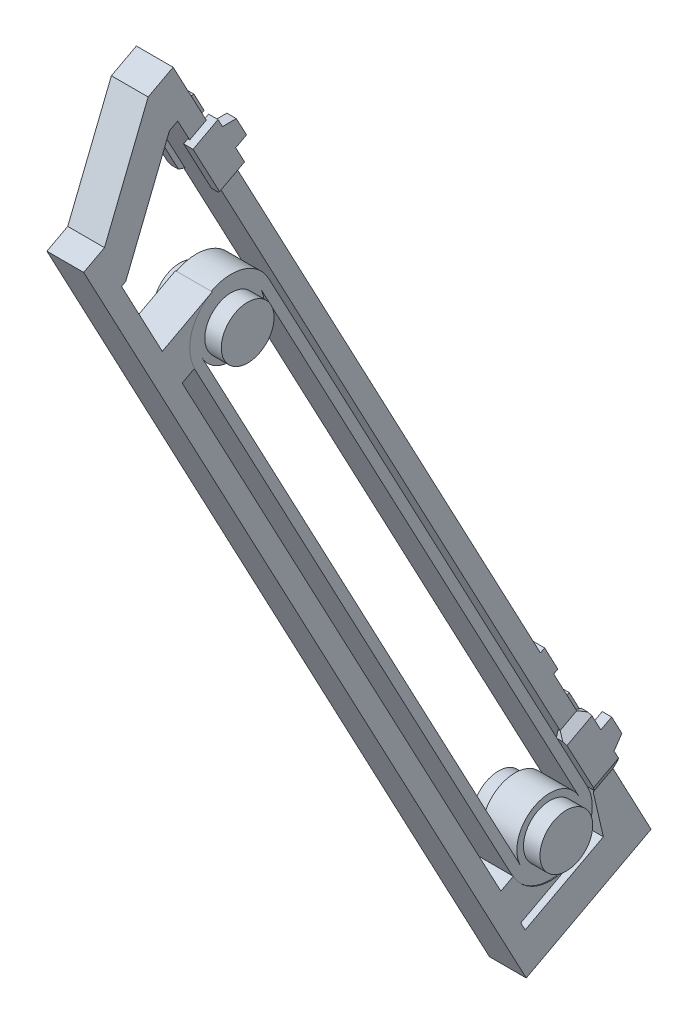
from build123d import *

# Parameters (mm, degrees)
BOSS_EXTRUDE1_DEPTH   = 19.5
SKETCH3_R             = 28
BOSS_EXTRUDE2_DEPTH   = 36
BOSS_EXTRUDE2_2_DEPTH = 36
SKETCH4_R             = 35
BOSS_EXTRUDE3_DEPTH   = 18.5
BOSS_EXTRUDE4_DEPTH   = 18.5
BOSS_EXTRUDE5_START   = -2
BOSS_EXTRUDE5_DEPTH   = 10
MIRROR2_START         = -2
MIRROR2_COPY_1_DEPTH  = 10
CHAMFER1_SIZE         = 8
CHAMFER2_SIZE         = 13.856406461
CHAMFER2_SIZE_2       = 8
CHAMFER2_SIZE_3       = 9.797958971
BOSS_EXTRUDE6_START   = -39
BOSS_EXTRUDE6_DEPTH   = 39
SKETCH8_W             = 39
SKETCH8_H             = 30
BOSS_EXTRUDE7_DEPTH   = 5


with BuildPart() as part:
    # Sketch2 → Boss-Extrude1 (new, symmetric)
    with BuildSketch(Plane(origin=(0, 0, 0), x_dir=(0, 0, -1), z_dir=(1, 0, 0))):
        Polygon((0, 0), (132.442138929, 70.420734418), (-374.58714888, 1024.004134706), (-401.075576666, 1009.919987822), (-447.397872964, 894.684381929), (-469.471562786, 882.947592859), align=None)
        Polygon((-369.711465723, 972.233218993), (-378.540941652, 967.538503365), (-424.863237951, 852.302897471), (-429.277975915, 849.955539657), (-1.119910654, 44.70733497), (81.809218892, 88.801535309), (67.836030793, 149.326062448), align=None, mode=Mode.SUBTRACT)
    extrude(amount=BOSS_EXTRUDE1_DEPTH, both=True)

    # Sketch6 → Boss-Extrude5 (add)
    with BuildSketch(Plane(origin=(19.5, 0, 0), x_dir=(0, 0, -1), z_dir=(1, 0, 0)).offset(BOSS_EXTRUDE5_START)):
        Polygon((-361.450471492, 946.046276171), (-334.962043707, 960.130423055), (-330.267328079, 951.300947126), (-315.54391742, 951.300947126), (-304.704862488, 930.915649657), (-316.183181195, 924.812519341), (-306.79374994, 907.153567483), (-333.282177725, 893.0694206), align=None)
    boss_extrude5 = extrude(amount=BOSS_EXTRUDE5_DEPTH)

    # Mirror1: Boss-Extrude5 across plane
    add(boss_extrude5.mirror(Plane(origin=(0, 0, 0), x_dir=(0, 0, 1), z_dir=(1, 0, 0))))

    # Mirror2: Boss-Extrude5 across plane
    add(boss_extrude5.mirror(Plane(origin=(0, 487.828545055, 259.383038439), x_dir=(0, -0.4694715627858889, 0.8829475928589279), z_dir=(0, -0.882947592858928, -0.4694715627858889))))

    # Mirror2 copy 1 sketch → Mirror2 copy 1 (add)
    with BuildSketch(Plane(origin=(-19.5, 975.657090109, 518.766076878), x_dir=(0, 0.8290375725550394, -0.5591929034707503), z_dir=(-1, 0, 0)).offset(MIRROR2_START)):
        Polygon((-361.450471492, 946.046276171), (-334.962043707, 960.130423055), (-330.267328079, 951.300947126), (-315.54391742, 951.300947126), (-304.704862488, 930.915649657), (-316.183181195, 924.812519341), (-306.79374994, 907.153567483), (-333.282177725, 893.0694206), align=None)
    extrude(amount=MIRROR2_COPY_1_DEPTH)

    # Chamfer1
    # the kernel refuses this chamfer: 8 mm, written as the material it adds along each edge
    with BuildSketch(Plane(origin=(19.5, 895.416778414, 328.867439761), x_dir=(0, -0.8697052331433146, -0.49357148159423986), z_dir=(-1, 0, 0))) as chamfer1_piece_1_section:
        Polygon((CHAMFER1_SIZE * 0.999621916911, CHAMFER1_SIZE * 0.0274958766106), (-CHAMFER1_SIZE * 0.0274958766106, CHAMFER1_SIZE * 0.999621916911), (0, 0), align=None)
    chamfer1_piece_1 = extrude(amount=2, mode=Mode.PRIVATE)
    chamfer1_piece_1 = split(chamfer1_piece_1, bisect_by=Plane(origin=(18.5, 890.45049523, 331.889670405), z_dir=(0, 0.46947156278588875, -0.8829475928589281)), keep=Keep.TOP, mode=Mode.PRIVATE)
    add(chamfer1_piece_1)
    with BuildSketch(Plane(origin=(19.5, 895.416778414, 328.867439761), x_dir=(-0.027495876610586622, -0.8826137653058558, -0.4692940635273741), z_dir=(0, 0.46947156278589053, -0.8829475928589271))) as chamfer1_piece_2_section:
        Polygon((CHAMFER1_SIZE * 0.999621916911, -CHAMFER1_SIZE * 0.0274958766106), (-CHAMFER1_SIZE * 0.0274958766106, -CHAMFER1_SIZE * 0.999621916911), (0, 0), align=None)
    chamfer1_piece_2 = extrude(amount=20, mode=Mode.PRIVATE)
    chamfer1_piece_2 = split(chamfer1_piece_2, bisect_by=Plane(origin=(27.5, 897.77765762, 318.797040995), z_dir=(-1, 0, 0)), keep=Keep.TOP, mode=Mode.PRIVATE)
    add(chamfer1_piece_2)
    with BuildSketch(Plane(origin=(19.5, 904.80620967, 311.208487904), x_dir=(0, -0.8955222974683966, -0.4450166454605094), z_dir=(-1, 0, 0))) as chamfer1_piece_3_section:
        Polygon((CHAMFER1_SIZE * 0.999621916911, -CHAMFER1_SIZE * 0.0274958766106), (-CHAMFER1_SIZE * 0.0274958766106, -CHAMFER1_SIZE * 0.999621916911), (0, 0), align=None)
    chamfer1_piece_3 = extrude(amount=2, mode=Mode.PRIVATE)
    chamfer1_piece_3 = split(chamfer1_piece_3, bisect_by=Plane(origin=(18.5, 904.534642113, 305.401242619), z_dir=(0, -0.46947156278588786, 0.8829475928589285)), keep=Keep.TOP, mode=Mode.PRIVATE)
    add(chamfer1_piece_3)
    with BuildSketch(Plane(origin=(-19.5, 202.30291802, -39.667737026), x_dir=(0, 0.8955222974683965, 0.4450166454605094), z_dir=(1, 0, 0))) as chamfer1_piece_4_section:
        Polygon((CHAMFER1_SIZE * 0.999621916911, CHAMFER1_SIZE * 0.0274958766106), (-CHAMFER1_SIZE * 0.0274958766106, CHAMFER1_SIZE * 0.999621916911), (0, 0), align=None)
    chamfer1_piece_4 = extrude(amount=2, mode=Mode.PRIVATE)
    chamfer1_piece_4 = split(chamfer1_piece_4, bisect_by=Plane(origin=(-18.5, 202.574485576, -33.860491741), z_dir=(0, 0.46947156278588914, -0.8829475928589279)), keep=Keep.TOP, mode=Mode.PRIVATE)
    add(chamfer1_piece_4)
    with BuildSketch(Plane(origin=(-19.5, 211.692349275, -57.326688883), x_dir=(0.027495876610586403, 0.8826137653058576, 0.4692940635273708), z_dir=(0, -0.46947156278588736, 0.8829475928589289))) as chamfer1_piece_5_section:
        Polygon((CHAMFER1_SIZE * 0.999621916911, CHAMFER1_SIZE * 0.0274958766106), (-CHAMFER1_SIZE * 0.0274958766106, CHAMFER1_SIZE * 0.999621916911), (0, 0), align=None)
    chamfer1_piece_5 = extrude(amount=20, mode=Mode.PRIVATE)
    chamfer1_piece_5 = split(chamfer1_piece_5, bisect_by=Plane(origin=(-27.5, 209.331470069, -47.256290117), z_dir=(1, 0, 0)), keep=Keep.TOP, mode=Mode.PRIVATE)
    add(chamfer1_piece_5)
    with BuildSketch(Plane(origin=(-19.5, 211.692349275, -57.326688883), x_dir=(0, 0.8697052331433184, 0.49357148159423286), z_dir=(1, 0, 0))) as chamfer1_piece_6_section:
        Polygon((CHAMFER1_SIZE * 0.999621916911, -CHAMFER1_SIZE * 0.0274958766106), (-CHAMFER1_SIZE * 0.0274958766106, -CHAMFER1_SIZE * 0.999621916911), (0, 0), align=None)
    chamfer1_piece_6 = extrude(amount=2, mode=Mode.PRIVATE)
    chamfer1_piece_6 = split(chamfer1_piece_6, bisect_by=Plane(origin=(-18.5, 216.658632459, -60.348919527), z_dir=(0, -0.46947156278589003, 0.8829475928589274)), keep=Keep.TOP, mode=Mode.PRIVATE)
    add(chamfer1_piece_6)
    with BuildSketch(Plane(origin=(19.5, 202.30291802, -39.667737026), x_dir=(0, 0.8955222974683955, 0.4450166454605115), z_dir=(-1, 0, 0))) as chamfer1_piece_7_section:
        Polygon((CHAMFER1_SIZE * 0.999621916911, -CHAMFER1_SIZE * 0.0274958766106), (-CHAMFER1_SIZE * 0.0274958766106, -CHAMFER1_SIZE * 0.999621916911), (0, 0), align=None)
    chamfer1_piece_7 = extrude(amount=2, mode=Mode.PRIVATE)
    chamfer1_piece_7 = split(chamfer1_piece_7, bisect_by=Plane(origin=(18.5, 202.574485576, -33.860491741), z_dir=(0, 0.4694715627858891, -0.8829475928589279)), keep=Keep.TOP, mode=Mode.PRIVATE)
    add(chamfer1_piece_7)
    with BuildSketch(Plane(origin=(19.5, 202.30291802, -39.667737026), x_dir=(0.9996219169112968, -0.024277418066865994, -0.012908532162541309), z_dir=(0, 0.4694715627858873, -0.8829475928589289))) as chamfer1_piece_8_section:
        Polygon((CHAMFER1_SIZE * 0.999621916911, -CHAMFER1_SIZE * 0.0274958766106), (-CHAMFER1_SIZE * 0.0274958766106, -CHAMFER1_SIZE * 0.999621916911), (0, 0), align=None)
    chamfer1_piece_8 = extrude(amount=20, mode=Mode.PRIVATE)
    chamfer1_piece_8 = split(chamfer1_piece_8, bisect_by=Plane(origin=(27.5, 209.331470069, -47.256290117), z_dir=(-1, 0, 0)), keep=Keep.TOP, mode=Mode.PRIVATE)
    add(chamfer1_piece_8)
    with BuildSketch(Plane(origin=(19.5, 211.692349275, -57.326688883), x_dir=(0, 0.8697052331433177, 0.493571481594234), z_dir=(-1, 0, 0))) as chamfer1_piece_9_section:
        Polygon((CHAMFER1_SIZE * 0.999621916911, CHAMFER1_SIZE * 0.0274958766106), (-CHAMFER1_SIZE * 0.0274958766106, CHAMFER1_SIZE * 0.999621916911), (0, 0), align=None)
    chamfer1_piece_9 = extrude(amount=2, mode=Mode.PRIVATE)
    chamfer1_piece_9 = split(chamfer1_piece_9, bisect_by=Plane(origin=(18.5, 216.658632459, -60.348919527), z_dir=(0, -0.4694715627858899, 0.8829475928589274)), keep=Keep.TOP, mode=Mode.PRIVATE)
    add(chamfer1_piece_9)
    with BuildSketch(Plane(origin=(-19.5, 895.416778414, 328.867439761), x_dir=(0, -0.8697052331433146, -0.49357148159423986), z_dir=(1, 0, 0))) as chamfer1_piece_10_section:
        Polygon((CHAMFER1_SIZE * 0.999621916911, -CHAMFER1_SIZE * 0.0274958766106), (-CHAMFER1_SIZE * 0.0274958766106, -CHAMFER1_SIZE * 0.999621916911), (0, 0), align=None)
    chamfer1_piece_10 = extrude(amount=2, mode=Mode.PRIVATE)
    chamfer1_piece_10 = split(chamfer1_piece_10, bisect_by=Plane(origin=(-18.5, 890.45049523, 331.889670405), z_dir=(0, 0.46947156278588875, -0.8829475928589281)), keep=Keep.TOP, mode=Mode.PRIVATE)
    add(chamfer1_piece_10)
    with BuildSketch(Plane(origin=(-19.5, 904.80620967, 311.208487904), x_dir=(-0.9996219169112972, 0.024277418066848726, 0.012908532162532243), z_dir=(0, -0.46947156278589053, 0.8829475928589271))) as chamfer1_piece_11_section:
        Polygon((CHAMFER1_SIZE * 0.999621916911, CHAMFER1_SIZE * 0.0274958766106), (-CHAMFER1_SIZE * 0.0274958766106, CHAMFER1_SIZE * 0.999621916911), (0, 0), align=None)
    chamfer1_piece_11 = extrude(amount=20, mode=Mode.PRIVATE)
    chamfer1_piece_11 = split(chamfer1_piece_11, bisect_by=Plane(origin=(-27.5, 897.77765762, 318.797040995), z_dir=(1, 0, 0)), keep=Keep.TOP, mode=Mode.PRIVATE)
    add(chamfer1_piece_11)
    with BuildSketch(Plane(origin=(-19.5, 904.80620967, 311.208487904), x_dir=(0, -0.8955222974683966, -0.4450166454605094), z_dir=(1, 0, 0))) as chamfer1_piece_12_section:
        Polygon((CHAMFER1_SIZE * 0.999621916911, CHAMFER1_SIZE * 0.0274958766106), (-CHAMFER1_SIZE * 0.0274958766106, CHAMFER1_SIZE * 0.999621916911), (0, 0), align=None)
    chamfer1_piece_12 = extrude(amount=2, mode=Mode.PRIVATE)
    chamfer1_piece_12 = split(chamfer1_piece_12, bisect_by=Plane(origin=(-18.5, 904.534642113, 305.401242619), z_dir=(0, -0.46947156278588786, 0.8829475928589285)), keep=Keep.TOP, mode=Mode.PRIVATE)
    add(chamfer1_piece_12)
    with BuildSketch(Plane(origin=(40.073463904, 895.416778414, 328.867439761), x_dir=(0, -0.8697052331433148, -0.4935714815942391), z_dir=(-1, 0, 0))) as chamfer1_piece_13a_section:
        Polygon((CHAMFER1_SIZE * 0.999621916911, CHAMFER1_SIZE * 0.0274958766106), (-CHAMFER1_SIZE * 0.0274958766106, CHAMFER1_SIZE * 0.999621916911), (0, 0), align=None)
    chamfer1_piece_13a = extrude(amount=22.573463904, mode=Mode.PRIVATE)
    chamfer1_piece_13a = split(chamfer1_piece_13a, bisect_by=Plane(origin=(19.5, 891.853347168, 329.251289638), z_dir=(1, 0, 0)), keep=Keep.TOP, mode=Mode.PRIVATE)
    chamfer1_piece_13a = split(chamfer1_piece_13a, bisect_by=Plane(origin=(23.5, 890.45049523, 331.889670405), z_dir=(0, 0.46947156278588875, -0.8829475928589281)), keep=Keep.TOP, mode=Mode.PRIVATE)
    chamfer1_piece_13a = split(chamfer1_piece_13a, bisect_by=Plane(origin=(27.5, 891.853347168, 329.251289638), z_dir=(-1, 0, 0)), keep=Keep.TOP, mode=Mode.PRIVATE)
    with BuildSketch(Plane(origin=(19.5, 885.758122163, 347.032730192), x_dir=(-0.027495876610586622, -0.8826137653058558, -0.4692940635273741), z_dir=(0, 0.46947156278589053, -0.8829475928589271))) as chamfer1_piece_13b_section:
        Polygon((CHAMFER1_SIZE * 0.999621916911, -CHAMFER1_SIZE * 0.0274958766106), (-CHAMFER1_SIZE * 0.0274958766106, -CHAMFER1_SIZE * 0.999621916911), (0, 0), align=None)
    chamfer1_piece_13b = extrude(amount=40.573463904, mode=Mode.PRIVATE)
    chamfer1_piece_13b = split(chamfer1_piece_13b, bisect_by=Plane(origin=(22.12907467, 893.082941992, 327.626516924), z_dir=(0, -0.46947156278588986, 0.8829475928589274)), keep=Keep.TOP, mode=Mode.PRIVATE)
    chamfer1_piece_13b = split(chamfer1_piece_13b, bisect_by=Plane(origin=(22.12907467, 890.735584178, 332.041254888), z_dir=(0, 0.46947156278588875, -0.8829475928589281)), keep=Keep.TOP, mode=Mode.PRIVATE)
    chamfer1_piece_13b = split(chamfer1_piece_13b, bisect_by=Plane(origin=(27.5, 891.909263085, 329.833885906), z_dir=(-1, 0, 0)), keep=Keep.TOP, mode=Mode.PRIVATE)
    chamfer1_piece_13 = chamfer1_piece_13a & chamfer1_piece_13b
    add(chamfer1_piece_13)
    with BuildSketch(Plane(origin=(40.073463904, 904.80620967, 311.208487904), x_dir=(0, -0.8955222974684021, -0.44501664546049835), z_dir=(-1, 0, 0))) as chamfer1_piece_14a_section:
        Polygon((CHAMFER1_SIZE * 0.999621916911, -CHAMFER1_SIZE * 0.0274958766106), (-CHAMFER1_SIZE * 0.0274958766106, -CHAMFER1_SIZE * 0.999621916911), (0, 0), align=None)
    chamfer1_piece_14a = extrude(amount=22.573463904, mode=Mode.PRIVATE)
    chamfer1_piece_14a = split(chamfer1_piece_14a, bisect_by=Plane(origin=(19.5, 903.131790175, 308.039623386), z_dir=(1, 0, 0)), keep=Keep.TOP, mode=Mode.PRIVATE)
    chamfer1_piece_14a = split(chamfer1_piece_14a, bisect_by=Plane(origin=(27.5, 903.131790175, 308.039623386), z_dir=(-1, 0, 0)), keep=Keep.TOP, mode=Mode.PRIVATE)
    chamfer1_piece_14a = split(chamfer1_piece_14a, bisect_by=Plane(origin=(23.5, 904.534642113, 305.401242619), z_dir=(0, -0.46947156278588786, 0.8829475928589285)), keep=Keep.TOP, mode=Mode.PRIVATE)
    with BuildSketch(Plane(origin=(19.5, 895.416778414, 328.867439761), x_dir=(-0.027495876610586622, -0.8826137653058558, -0.4692940635273741), z_dir=(0, 0.46947156278589053, -0.8829475928589271))) as chamfer1_piece_14b_section:
        Polygon((CHAMFER1_SIZE * 0.999621916911, -CHAMFER1_SIZE * 0.0274958766106), (-CHAMFER1_SIZE * 0.0274958766106, -CHAMFER1_SIZE * 0.999621916911), (0, 0), align=None)
    chamfer1_piece_14b = extrude(amount=40.573463904, mode=Mode.PRIVATE)
    chamfer1_piece_14b = split(chamfer1_piece_14b, bisect_by=Plane(origin=(22.12907467, 902.472373248, 309.967565066), z_dir=(0, 0.469471562785889, -0.882947592858928)), keep=Keep.TOP, mode=Mode.PRIVATE)
    chamfer1_piece_14b = split(chamfer1_piece_14b, bisect_by=Plane(origin=(27.5, 903.646052155, 307.760196084), z_dir=(-1, 0, 0)), keep=Keep.TOP, mode=Mode.PRIVATE)
    chamfer1_piece_14b = split(chamfer1_piece_14b, bisect_by=Plane(origin=(22.12907467, 904.819731062, 305.552827102), z_dir=(0, -0.46947156278588786, 0.8829475928589285)), keep=Keep.TOP, mode=Mode.PRIVATE)
    chamfer1_piece_14 = chamfer1_piece_14a & chamfer1_piece_14b
    add(chamfer1_piece_14)
    with BuildSketch(Plane(origin=(-40.073463904, 202.30291802, -39.667737026), x_dir=(0, 0.8955222974683965, 0.4450166454605094), z_dir=(1, 0, 0))) as chamfer1_piece_15a_section:
        Polygon((CHAMFER1_SIZE * 0.999621916911, CHAMFER1_SIZE * 0.0274958766106), (-CHAMFER1_SIZE * 0.0274958766106, CHAMFER1_SIZE * 0.999621916911), (0, 0), align=None)
    chamfer1_piece_15a = extrude(amount=22.573463904, mode=Mode.PRIVATE)
    chamfer1_piece_15a = split(chamfer1_piece_15a, bisect_by=Plane(origin=(-19.5, 203.977337514, -36.498872509), z_dir=(-1, 0, 0)), keep=Keep.TOP, mode=Mode.PRIVATE)
    chamfer1_piece_15a = split(chamfer1_piece_15a, bisect_by=Plane(origin=(-23.5, 202.574485576, -33.860491741), z_dir=(0, 0.46947156278588914, -0.8829475928589279)), keep=Keep.TOP, mode=Mode.PRIVATE)
    chamfer1_piece_15a = split(chamfer1_piece_15a, bisect_by=Plane(origin=(-27.5, 203.977337514, -36.498872509), z_dir=(1, 0, 0)), keep=Keep.TOP, mode=Mode.PRIVATE)
    with BuildSketch(Plane(origin=(-19.5, 211.692349275, -57.326688883), x_dir=(0.027495876610586403, 0.8826137653058576, 0.4692940635273708), z_dir=(0, -0.46947156278588736, 0.8829475928589289))) as chamfer1_piece_15b_section:
        Polygon((CHAMFER1_SIZE * 0.999621916911, CHAMFER1_SIZE * 0.0274958766106), (-CHAMFER1_SIZE * 0.0274958766106, CHAMFER1_SIZE * 0.999621916911), (0, 0), align=None)
    chamfer1_piece_15b = extrude(amount=40.573463904, mode=Mode.PRIVATE)
    chamfer1_piece_15b = split(chamfer1_piece_15b, bisect_by=Plane(origin=(-22.12907467, 204.636754441, -38.426814188), z_dir=(0, -0.46947156278588986, 0.8829475928589274)), keep=Keep.TOP, mode=Mode.PRIVATE)
    chamfer1_piece_15b = split(chamfer1_piece_15b, bisect_by=Plane(origin=(-22.12907467, 202.289396627, -34.012076224), z_dir=(0, 0.46947156278588914, -0.8829475928589279)), keep=Keep.TOP, mode=Mode.PRIVATE)
    chamfer1_piece_15b = split(chamfer1_piece_15b, bisect_by=Plane(origin=(-27.5, 203.463075534, -36.219445206), z_dir=(1, 0, 0)), keep=Keep.TOP, mode=Mode.PRIVATE)
    chamfer1_piece_15 = chamfer1_piece_15a & chamfer1_piece_15b
    add(chamfer1_piece_15)
    with BuildSketch(Plane(origin=(-40.073463904, 211.692349275, -57.326688883), x_dir=(0, 0.869705233143318, 0.49357148159423353), z_dir=(1, 0, 0))) as chamfer1_piece_16a_section:
        Polygon((CHAMFER1_SIZE * 0.999621916911, -CHAMFER1_SIZE * 0.0274958766106), (-CHAMFER1_SIZE * 0.0274958766106, -CHAMFER1_SIZE * 0.999621916911), (0, 0), align=None)
    chamfer1_piece_16a = extrude(amount=22.573463904, mode=Mode.PRIVATE)
    chamfer1_piece_16a = split(chamfer1_piece_16a, bisect_by=Plane(origin=(-19.5, 215.255780521, -57.71053876), z_dir=(-1, 0, 0)), keep=Keep.TOP, mode=Mode.PRIVATE)
    chamfer1_piece_16a = split(chamfer1_piece_16a, bisect_by=Plane(origin=(-27.5, 215.255780521, -57.71053876), z_dir=(1, 0, 0)), keep=Keep.TOP, mode=Mode.PRIVATE)
    chamfer1_piece_16a = split(chamfer1_piece_16a, bisect_by=Plane(origin=(-23.5, 216.658632459, -60.348919527), z_dir=(0, -0.46947156278589003, 0.8829475928589274)), keep=Keep.TOP, mode=Mode.PRIVATE)
    with BuildSketch(Plane(origin=(-19.5, 221.351005526, -75.491979314), x_dir=(0.02749587661058658, 0.8826137653058576, 0.46929406352737085), z_dir=(0, -0.46947156278588736, 0.8829475928589289))) as chamfer1_piece_16b_section:
        Polygon((CHAMFER1_SIZE * 0.999621916911, CHAMFER1_SIZE * 0.0274958766106), (-CHAMFER1_SIZE * 0.0274958766106, CHAMFER1_SIZE * 0.999621916911), (0, 0), align=None)
    chamfer1_piece_16b = extrude(amount=40.573463904, mode=Mode.PRIVATE)
    chamfer1_piece_16b = split(chamfer1_piece_16b, bisect_by=Plane(origin=(-22.12907467, 214.026185697, -56.085766046), z_dir=(0, 0.469471562785889, -0.882947592858928)), keep=Keep.TOP, mode=Mode.PRIVATE)
    chamfer1_piece_16b = split(chamfer1_piece_16b, bisect_by=Plane(origin=(-27.5, 215.199864604, -58.293135028), z_dir=(1, 0, 0)), keep=Keep.TOP, mode=Mode.PRIVATE)
    chamfer1_piece_16b = split(chamfer1_piece_16b, bisect_by=Plane(origin=(-22.12907467, 216.373543511, -60.50050401), z_dir=(0, -0.46947156278589003, 0.8829475928589274)), keep=Keep.TOP, mode=Mode.PRIVATE)
    chamfer1_piece_16 = chamfer1_piece_16a & chamfer1_piece_16b
    add(chamfer1_piece_16)
    with BuildSketch(Plane(origin=(40.073463904, 202.30291802, -39.667737026), x_dir=(0, 0.8955222974683955, 0.4450166454605115), z_dir=(-1, 0, 0))) as chamfer1_piece_17a_section:
        Polygon((CHAMFER1_SIZE * 0.999621916911, -CHAMFER1_SIZE * 0.0274958766106), (-CHAMFER1_SIZE * 0.0274958766106, -CHAMFER1_SIZE * 0.999621916911), (0, 0), align=None)
    chamfer1_piece_17a = extrude(amount=22.573463904, mode=Mode.PRIVATE)
    chamfer1_piece_17a = split(chamfer1_piece_17a, bisect_by=Plane(origin=(19.5, 203.977337514, -36.498872509), z_dir=(1, 0, 0)), keep=Keep.TOP, mode=Mode.PRIVATE)
    chamfer1_piece_17a = split(chamfer1_piece_17a, bisect_by=Plane(origin=(23.5, 202.574485576, -33.860491741), z_dir=(0, 0.4694715627858891, -0.8829475928589279)), keep=Keep.TOP, mode=Mode.PRIVATE)
    chamfer1_piece_17a = split(chamfer1_piece_17a, bisect_by=Plane(origin=(27.5, 203.977337514, -36.498872509), z_dir=(-1, 0, 0)), keep=Keep.TOP, mode=Mode.PRIVATE)
    with BuildSketch(Plane(origin=(19.5, 192.644261769, -21.502446595), x_dir=(0.999621916911297, -0.024277418066861695, -0.012908532162539026), z_dir=(0, 0.4694715627858873, -0.8829475928589289))) as chamfer1_piece_17b_section:
        Polygon((CHAMFER1_SIZE * 0.999621916911, -CHAMFER1_SIZE * 0.0274958766106), (-CHAMFER1_SIZE * 0.0274958766106, -CHAMFER1_SIZE * 0.999621916911), (0, 0), align=None)
    chamfer1_piece_17b = extrude(amount=40.573463904, mode=Mode.PRIVATE)
    chamfer1_piece_17b = split(chamfer1_piece_17b, bisect_by=Plane(origin=(22.12907467, 204.636754441, -38.426814188), z_dir=(0, -0.46947156278588986, 0.8829475928589274)), keep=Keep.TOP, mode=Mode.PRIVATE)
    chamfer1_piece_17b = split(chamfer1_piece_17b, bisect_by=Plane(origin=(22.12907467, 202.289396627, -34.012076224), z_dir=(0, 0.4694715627858891, -0.8829475928589279)), keep=Keep.TOP, mode=Mode.PRIVATE)
    chamfer1_piece_17b = split(chamfer1_piece_17b, bisect_by=Plane(origin=(27.5, 203.463075534, -36.219445206), z_dir=(-1, 0, 0)), keep=Keep.TOP, mode=Mode.PRIVATE)
    chamfer1_piece_17 = chamfer1_piece_17a & chamfer1_piece_17b
    add(chamfer1_piece_17)
    with BuildSketch(Plane(origin=(40.073463904, 211.692349275, -57.326688883), x_dir=(0, 0.8697052331433165, 0.49357148159423614), z_dir=(-1, 0, 0))) as chamfer1_piece_18a_section:
        Polygon((CHAMFER1_SIZE * 0.999621916911, CHAMFER1_SIZE * 0.0274958766106), (-CHAMFER1_SIZE * 0.0274958766106, CHAMFER1_SIZE * 0.999621916911), (0, 0), align=None)
    chamfer1_piece_18a = extrude(amount=22.573463904, mode=Mode.PRIVATE)
    chamfer1_piece_18a = split(chamfer1_piece_18a, bisect_by=Plane(origin=(19.5, 215.255780521, -57.71053876), z_dir=(1, 0, 0)), keep=Keep.TOP, mode=Mode.PRIVATE)
    chamfer1_piece_18a = split(chamfer1_piece_18a, bisect_by=Plane(origin=(27.5, 215.255780521, -57.71053876), z_dir=(-1, 0, 0)), keep=Keep.TOP, mode=Mode.PRIVATE)
    chamfer1_piece_18a = split(chamfer1_piece_18a, bisect_by=Plane(origin=(23.5, 216.658632459, -60.348919527), z_dir=(0, -0.4694715627858899, 0.8829475928589274)), keep=Keep.TOP, mode=Mode.PRIVATE)
    with BuildSketch(Plane(origin=(19.5, 202.30291802, -39.667737026), x_dir=(0.9996219169112968, -0.024277418066865994, -0.012908532162541309), z_dir=(0, 0.4694715627858873, -0.8829475928589289))) as chamfer1_piece_18b_section:
        Polygon((CHAMFER1_SIZE * 0.999621916911, -CHAMFER1_SIZE * 0.0274958766106), (-CHAMFER1_SIZE * 0.0274958766106, -CHAMFER1_SIZE * 0.999621916911), (0, 0), align=None)
    chamfer1_piece_18b = extrude(amount=40.573463904, mode=Mode.PRIVATE)
    chamfer1_piece_18b = split(chamfer1_piece_18b, bisect_by=Plane(origin=(22.12907467, 214.026185697, -56.085766046), z_dir=(0, 0.469471562785889, -0.882947592858928)), keep=Keep.TOP, mode=Mode.PRIVATE)
    chamfer1_piece_18b = split(chamfer1_piece_18b, bisect_by=Plane(origin=(27.5, 215.199864604, -58.293135028), z_dir=(-1, 0, 0)), keep=Keep.TOP, mode=Mode.PRIVATE)
    chamfer1_piece_18b = split(chamfer1_piece_18b, bisect_by=Plane(origin=(22.12907467, 216.373543511, -60.50050401), z_dir=(0, -0.4694715627858899, 0.8829475928589274)), keep=Keep.TOP, mode=Mode.PRIVATE)
    chamfer1_piece_18 = chamfer1_piece_18a & chamfer1_piece_18b
    add(chamfer1_piece_18)
    with BuildSketch(Plane(origin=(-40.073463904, 895.416778414, 328.867439761), x_dir=(0, -0.8697052331433148, -0.4935714815942391), z_dir=(1, 0, 0))) as chamfer1_piece_19a_section:
        Polygon((CHAMFER1_SIZE * 0.999621916911, -CHAMFER1_SIZE * 0.0274958766106), (-CHAMFER1_SIZE * 0.0274958766106, -CHAMFER1_SIZE * 0.999621916911), (0, 0), align=None)
    chamfer1_piece_19a = extrude(amount=22.573463904, mode=Mode.PRIVATE)
    chamfer1_piece_19a = split(chamfer1_piece_19a, bisect_by=Plane(origin=(-19.5, 891.853347168, 329.251289638), z_dir=(-1, 0, 0)), keep=Keep.TOP, mode=Mode.PRIVATE)
    chamfer1_piece_19a = split(chamfer1_piece_19a, bisect_by=Plane(origin=(-23.5, 890.45049523, 331.889670405), z_dir=(0, 0.46947156278588875, -0.8829475928589281)), keep=Keep.TOP, mode=Mode.PRIVATE)
    chamfer1_piece_19a = split(chamfer1_piece_19a, bisect_by=Plane(origin=(-27.5, 891.853347168, 329.251289638), z_dir=(1, 0, 0)), keep=Keep.TOP, mode=Mode.PRIVATE)
    with BuildSketch(Plane(origin=(-19.5, 904.80620967, 311.208487904), x_dir=(-0.9996219169112972, 0.024277418066848726, 0.012908532162532243), z_dir=(0, -0.46947156278589053, 0.8829475928589271))) as chamfer1_piece_19b_section:
        Polygon((CHAMFER1_SIZE * 0.999621916911, CHAMFER1_SIZE * 0.0274958766106), (-CHAMFER1_SIZE * 0.0274958766106, CHAMFER1_SIZE * 0.999621916911), (0, 0), align=None)
    chamfer1_piece_19b = extrude(amount=40.573463904, mode=Mode.PRIVATE)
    chamfer1_piece_19b = split(chamfer1_piece_19b, bisect_by=Plane(origin=(-22.12907467, 893.082941992, 327.626516924), z_dir=(0, -0.46947156278588986, 0.8829475928589274)), keep=Keep.TOP, mode=Mode.PRIVATE)
    chamfer1_piece_19b = split(chamfer1_piece_19b, bisect_by=Plane(origin=(-22.12907467, 890.735584178, 332.041254888), z_dir=(0, 0.46947156278588875, -0.8829475928589281)), keep=Keep.TOP, mode=Mode.PRIVATE)
    chamfer1_piece_19b = split(chamfer1_piece_19b, bisect_by=Plane(origin=(-27.5, 891.909263085, 329.833885906), z_dir=(1, 0, 0)), keep=Keep.TOP, mode=Mode.PRIVATE)
    chamfer1_piece_19 = chamfer1_piece_19a & chamfer1_piece_19b
    add(chamfer1_piece_19)
    with BuildSketch(Plane(origin=(-40.073463904, 904.80620967, 311.208487904), x_dir=(0, -0.8955222974684021, -0.44501664546049835), z_dir=(1, 0, 0))) as chamfer1_piece_20a_section:
        Polygon((CHAMFER1_SIZE * 0.999621916911, CHAMFER1_SIZE * 0.0274958766106), (-CHAMFER1_SIZE * 0.0274958766106, CHAMFER1_SIZE * 0.999621916911), (0, 0), align=None)
    chamfer1_piece_20a = extrude(amount=22.573463904, mode=Mode.PRIVATE)
    chamfer1_piece_20a = split(chamfer1_piece_20a, bisect_by=Plane(origin=(-19.5, 903.131790175, 308.039623386), z_dir=(-1, 0, 0)), keep=Keep.TOP, mode=Mode.PRIVATE)
    chamfer1_piece_20a = split(chamfer1_piece_20a, bisect_by=Plane(origin=(-27.5, 903.131790175, 308.039623386), z_dir=(1, 0, 0)), keep=Keep.TOP, mode=Mode.PRIVATE)
    chamfer1_piece_20a = split(chamfer1_piece_20a, bisect_by=Plane(origin=(-23.5, 904.534642113, 305.401242619), z_dir=(0, -0.46947156278588786, 0.8829475928589285)), keep=Keep.TOP, mode=Mode.PRIVATE)
    with BuildSketch(Plane(origin=(-19.5, 914.46486592, 293.043197473), x_dir=(-0.999621916911297, 0.024277418066859492, 0.012908532162537966), z_dir=(0, -0.46947156278589053, 0.8829475928589271))) as chamfer1_piece_20b_section:
        Polygon((CHAMFER1_SIZE * 0.999621916911, CHAMFER1_SIZE * 0.0274958766106), (-CHAMFER1_SIZE * 0.0274958766106, CHAMFER1_SIZE * 0.999621916911), (0, 0), align=None)
    chamfer1_piece_20b = extrude(amount=40.573463904, mode=Mode.PRIVATE)
    chamfer1_piece_20b = split(chamfer1_piece_20b, bisect_by=Plane(origin=(-22.12907467, 902.472373248, 309.967565066), z_dir=(0, 0.469471562785889, -0.882947592858928)), keep=Keep.TOP, mode=Mode.PRIVATE)
    chamfer1_piece_20b = split(chamfer1_piece_20b, bisect_by=Plane(origin=(-27.5, 903.646052155, 307.760196084), z_dir=(1, 0, 0)), keep=Keep.TOP, mode=Mode.PRIVATE)
    chamfer1_piece_20b = split(chamfer1_piece_20b, bisect_by=Plane(origin=(-22.12907467, 904.819731062, 305.552827102), z_dir=(0, -0.46947156278588786, 0.8829475928589285)), keep=Keep.TOP, mode=Mode.PRIVATE)
    chamfer1_piece_20 = chamfer1_piece_20a & chamfer1_piece_20b
    add(chamfer1_piece_20)

    # Chamfer2
    # the kernel refuses this chamfer: 13.856406461, 9.797958971, 8 mm, written as the material it adds along each edge
    with BuildSketch(Plane(origin=(-19.5, 132.496581184, -36.184379981), x_dir=(0.01932676561270069, -0.882782676456912, -0.4693838751794984), z_dir=(0, 0.4694715627858866, -0.8829475928589292))) as chamfer2_piece_1_section:
        Polygon((CHAMFER2_SIZE * 0.99981322059, CHAMFER2_SIZE * 0.0193267656121), (-CHAMFER2_SIZE_2 * 0.0193267656127, CHAMFER2_SIZE_2 * 0.999813220622), (0, 0), align=None)
    chamfer2_piece_1 = extrude(amount=55.847711765, mode=Mode.PRIVATE)
    chamfer2_piece_1 = split(chamfer2_piece_1, bisect_by=Plane(origin=(-22.003999002, 147.151034855, -68.338175479), z_dir=(0, 0.2249510543438658, -0.9743700647852351)), keep=Keep.TOP, mode=Mode.PRIVATE)
    chamfer2_piece_1 = split(chamfer2_piece_1, bisect_by=Plane(origin=(-27.5, 149.46413752, -78.357323867), z_dir=(1, 0, 0)), keep=Keep.TOP, mode=Mode.PRIVATE)
    add(chamfer2_piece_1)
    with BuildSketch(Plane(origin=(18.347711765, 158.715493704, -85.49498265), x_dir=(0, 0.5198013851245328, -0.8542871414358391), z_dir=(-1, 0, 0))) as chamfer2_piece_2_section:
        Polygon((CHAMFER2_SIZE_2 * 0.998322743754, CHAMFER2_SIZE_2 * 0.0578938624027), (-CHAMFER2_SIZE * 0.0578938624007, CHAMFER2_SIZE * 0.998322743721), (0, 0), align=None)
    chamfer2_piece_2 = extrude(amount=37.847711765, mode=Mode.PRIVATE)
    chamfer2_piece_2 = split(chamfer2_piece_2, bisect_by=Plane(origin=(17.5, 155.011783336, -89.655357593), z_dir=(1, 0, 0)), keep=Keep.TOP, mode=Mode.PRIVATE)
    chamfer2_piece_2 = split(chamfer2_piece_2, bisect_by=Plane(origin=(17.923855882, 156.450898485, -92.361939541), z_dir=(0, -0.46947156278588537, 0.8829475928589299)), keep=Keep.TOP, mode=Mode.PRIVATE)
    add(chamfer2_piece_2)
    with BuildSketch(Plane(origin=(-17.5, 158.715493704, -85.49498265), x_dir=(0, 0.5198013851246214, -0.8542871414357852), z_dir=(-1, 0, 0))) as chamfer2_piece_3_section:
        Polygon((CHAMFER2_SIZE_2 * 0.998322743754, CHAMFER2_SIZE_2 * 0.0578938624028), (-CHAMFER2_SIZE * 0.0578938623969, CHAMFER2_SIZE * 0.998322743722), (0, 0), align=None)
    chamfer2_piece_3 = extrude(amount=2, mode=Mode.PRIVATE)
    chamfer2_piece_3 = split(chamfer2_piece_3, bisect_by=Plane(origin=(-18.5, 156.450898485, -92.361939541), z_dir=(0, -0.46947156278588537, 0.8829475928589299)), keep=Keep.TOP, mode=Mode.PRIVATE)
    add(chamfer2_piece_3)
    with BuildSketch(Plane(origin=(-18.347711765, 158.715493704, -85.49498265), x_dir=(0, 0.5198013851245253, -0.8542871414358436), z_dir=(1, 0, 0))) as chamfer2_piece_4_section:
        Polygon((CHAMFER2_SIZE_2 * 0.998322743754, -CHAMFER2_SIZE_2 * 0.0578938624027), (-CHAMFER2_SIZE * 0.0578938624007, -CHAMFER2_SIZE * 0.998322743721), (0, 0), align=None)
    chamfer2_piece_4 = extrude(amount=37.847711765, mode=Mode.PRIVATE)
    chamfer2_piece_4 = split(chamfer2_piece_4, bisect_by=Plane(origin=(-17.923855882, 156.450898485, -92.361939541), z_dir=(0, -0.46947156278588537, 0.8829475928589299)), keep=Keep.TOP, mode=Mode.PRIVATE)
    chamfer2_piece_4 = split(chamfer2_piece_4, bisect_by=Plane(origin=(-17.5, 155.011783336, -89.655357593), z_dir=(-1, 0, 0)), keep=Keep.TOP, mode=Mode.PRIVATE)
    add(chamfer2_piece_4)
    with BuildSketch(Plane(origin=(17.5, 158.715493704, -85.49498265), x_dir=(0, 0.5198013851246204, -0.8542871414357858), z_dir=(1, 0, 0))) as chamfer2_piece_5_section:
        Polygon((CHAMFER2_SIZE_2 * 0.998322743754, -CHAMFER2_SIZE_2 * 0.0578938624028), (-CHAMFER2_SIZE * 0.0578938623969, -CHAMFER2_SIZE * 0.998322743722), (0, 0), align=None)
    chamfer2_piece_5 = extrude(amount=2, mode=Mode.PRIVATE)
    chamfer2_piece_5 = split(chamfer2_piece_5, bisect_by=Plane(origin=(18.5, 156.450898485, -92.361939541), z_dir=(0, -0.46947156278588537, 0.8829475928589299)), keep=Keep.TOP, mode=Mode.PRIVATE)
    add(chamfer2_piece_5)
    with BuildSketch(Plane(origin=(19.5, 158.715493704, -85.49498265), x_dir=(0.9983227437537929, 0.05111724644973841, 0.027179522057889836), z_dir=(0, -0.4694715627858865, 0.8829475928589292))) as chamfer2_piece_6_section:
        Polygon((CHAMFER2_SIZE_2 * 0.998322743754, -CHAMFER2_SIZE_2 * 0.0578938624027), (-CHAMFER2_SIZE * 0.0578938624008, -CHAMFER2_SIZE * 0.998322743721), (0, 0), align=None)
    chamfer2_piece_6 = extrude(amount=55.847711765, mode=Mode.PRIVATE)
    chamfer2_piece_6 = split(chamfer2_piece_6, bisect_by=Plane(origin=(22.003999002, 147.151034855, -68.338175479), z_dir=(0, 0.2249510543438658, -0.9743700647852351)), keep=Keep.TOP, mode=Mode.PRIVATE)
    chamfer2_piece_6 = split(chamfer2_piece_6, bisect_by=Plane(origin=(27.5, 149.46413752, -78.357323867), z_dir=(-1, 0, 0)), keep=Keep.TOP, mode=Mode.PRIVATE)
    add(chamfer2_piece_6)
    with BuildSketch(Plane(origin=(-19.5, 132.496581184, -36.184379981), x_dir=(0.01932676561270069, -0.882782676456912, -0.4693838751794984), z_dir=(0, 0.4694715627858866, -0.8829475928589292))) as chamfer2_piece_7a_section:
        Polygon((CHAMFER2_SIZE * 0.99981322059, CHAMFER2_SIZE * 0.0193267656121), (-CHAMFER2_SIZE_2 * 0.0193267656127, CHAMFER2_SIZE_2 * 0.999813220622), (0, 0), align=None)
    chamfer2_piece_7a = extrude(amount=91.695423529, mode=Mode.PRIVATE)
    chamfer2_piece_7a = split(chamfer2_piece_7a, bisect_by=Plane(origin=(-22.053269847, 154.602434284, -87.681935137), z_dir=(0, 0.46947156278594565, -0.8829475928588978)), keep=Keep.TOP, mode=Mode.PRIVATE)
    chamfer2_piece_7a = split(chamfer2_piece_7a, bisect_by=Plane(origin=(-22.053269847, 156.949792098, -92.096673101), z_dir=(0, -0.4694715627858855, 0.8829475928589299)), keep=Keep.TOP, mode=Mode.PRIVATE)
    chamfer2_piece_7a = split(chamfer2_piece_7a, bisect_by=Plane(origin=(-27.5, 155.776113191, -89.889304119), z_dir=(1, 0, 0)), keep=Keep.TOP, mode=Mode.PRIVATE)
    with BuildSketch(Plane(origin=(-17.5, 158.715493704, -85.49498265), x_dir=(0, 0.5198013851246214, -0.8542871414357852), z_dir=(-1, 0, 0))) as chamfer2_piece_7b_section:
        Polygon((CHAMFER2_SIZE_2 * 0.998322743754, CHAMFER2_SIZE_2 * 0.0578938624028), (-CHAMFER2_SIZE * 0.0578938623969, CHAMFER2_SIZE * 0.998322743722), (0, 0), align=None)
    chamfer2_piece_7b = extrude(amount=37.847711765, mode=Mode.PRIVATE)
    chamfer2_piece_7b = split(chamfer2_piece_7b, bisect_by=Plane(origin=(-23.5, 156.450898485, -92.361939541), z_dir=(0, -0.46947156278588537, 0.8829475928589299)), keep=Keep.TOP, mode=Mode.PRIVATE)
    chamfer2_piece_7b = split(chamfer2_piece_7b, bisect_by=Plane(origin=(-19.5, 155.011783336, -89.655357593), z_dir=(-1, 0, 0)), keep=Keep.TOP, mode=Mode.PRIVATE)
    chamfer2_piece_7b = split(chamfer2_piece_7b, bisect_by=Plane(origin=(-27.5, 155.011783336, -89.655357593), z_dir=(1, 0, 0)), keep=Keep.TOP, mode=Mode.PRIVATE)
    chamfer2_piece_7 = chamfer2_piece_7a & chamfer2_piece_7b
    add(chamfer2_piece_7)
    with BuildSketch(Plane(origin=(19.5, 175.544974968, -117.146633462), x_dir=(0.9983227437537929, 0.05111724644973841, 0.027179522057889836), z_dir=(0, -0.4694715627858865, 0.8829475928589292))) as chamfer2_piece_8a_section:
        Polygon((CHAMFER2_SIZE_2 * 0.998322743754, -CHAMFER2_SIZE_2 * 0.0578938624027), (-CHAMFER2_SIZE * 0.0578938624008, -CHAMFER2_SIZE * 0.998322743721), (0, 0), align=None)
    chamfer2_piece_8a = extrude(amount=91.695423529, mode=Mode.PRIVATE)
    chamfer2_piece_8a = split(chamfer2_piece_8a, bisect_by=Plane(origin=(22.053269847, 156.949792098, -92.096673101), z_dir=(0, -0.46947156278588537, 0.8829475928589299)), keep=Keep.TOP, mode=Mode.PRIVATE)
    chamfer2_piece_8a = split(chamfer2_piece_8a, bisect_by=Plane(origin=(27.5, 155.776113191, -89.889304119), z_dir=(-1, 0, 0)), keep=Keep.TOP, mode=Mode.PRIVATE)
    chamfer2_piece_8a = split(chamfer2_piece_8a, bisect_by=Plane(origin=(22.053269847, 154.602434284, -87.681935137), z_dir=(0, 0.46947156278594565, -0.8829475928588978)), keep=Keep.TOP, mode=Mode.PRIVATE)
    with BuildSketch(Plane(origin=(17.5, 158.715493704, -85.49498265), x_dir=(0, 0.5198013851246204, -0.8542871414357858), z_dir=(1, 0, 0))) as chamfer2_piece_8b_section:
        Polygon((CHAMFER2_SIZE_2 * 0.998322743754, -CHAMFER2_SIZE_2 * 0.0578938624028), (-CHAMFER2_SIZE * 0.0578938623969, -CHAMFER2_SIZE * 0.998322743722), (0, 0), align=None)
    chamfer2_piece_8b = extrude(amount=37.847711765, mode=Mode.PRIVATE)
    chamfer2_piece_8b = split(chamfer2_piece_8b, bisect_by=Plane(origin=(23.5, 156.450898485, -92.361939541), z_dir=(0, -0.46947156278588537, 0.8829475928589299)), keep=Keep.TOP, mode=Mode.PRIVATE)
    chamfer2_piece_8b = split(chamfer2_piece_8b, bisect_by=Plane(origin=(27.5, 155.011783336, -89.655357593), z_dir=(-1, 0, 0)), keep=Keep.TOP, mode=Mode.PRIVATE)
    chamfer2_piece_8b = split(chamfer2_piece_8b, bisect_by=Plane(origin=(19.5, 155.011783336, -89.655357593), z_dir=(1, 0, 0)), keep=Keep.TOP, mode=Mode.PRIVATE)
    chamfer2_piece_8 = chamfer2_piece_8a & chamfer2_piece_8b
    add(chamfer2_piece_8)
    # the kernel refuses this chamfer: 13.856406461, 9.797958971, 8 mm, written as the material it adds along each edge
    with BuildSketch(Plane(origin=(-17.5, 149.326062448, -67.836030793), x_dir=(-1.1116008428544358e-14, -0.43253618491336127, 0.9016165752361668), z_dir=(-1, 0, 0))) as chamfer2_2_piece_1_section:
        Polygon((CHAMFER2_SIZE_2 * 0.999143623479, -CHAMFER2_SIZE_2 * 0.0413765593161), (CHAMFER2_SIZE_3 * 0.218630711306, -CHAMFER2_SIZE_3 * 0.975807671676), (0, 0), align=None)
    chamfer2_2_piece_1 = extrude(amount=10, mode=Mode.PRIVATE)
    chamfer2_2_piece_1 = split(chamfer2_2_piece_1, bisect_by=Plane(origin=(-21.586824275, 146.535662977, -69.31971251), z_dir=(0, -0.46947156278588986, 0.8829475928589274)), keep=Keep.TOP, mode=Mode.PRIVATE)
    chamfer2_2_piece_1 = split(chamfer2_2_piece_1, bisect_by=Plane(origin=(-24.653246124, 143.683349418, -67.726338234), z_dir=(0.8660254037844396, 0.4414737964294631, 0.23473578139294246)), keep=Keep.TOP, mode=Mode.PRIVATE)
    chamfer2_2_piece_1 = split(chamfer2_2_piece_1, bisect_by=Plane(origin=(-21.586824275, 144.188305163, -64.904974545), z_dir=(0, 0.4694715627859457, -0.8829475928588979)), keep=Keep.TOP, mode=Mode.PRIVATE)
    add(chamfer2_2_piece_1)
    with BuildSketch(Plane(origin=(27.5, 149.326062448, -67.836030793), x_dir=(9.938599091345984e-15, -0.4325361849133816, 0.9016165752361571), z_dir=(-1, 0, 0))) as chamfer2_2_piece_2_section:
        Polygon((CHAMFER2_SIZE_2 * 0.999143623479, -CHAMFER2_SIZE_2 * 0.0413765593161), (CHAMFER2_SIZE_3 * 0.218630711306, -CHAMFER2_SIZE_3 * 0.975807671676), (0, 0), align=None)
    chamfer2_2_piece_2 = extrude(amount=10, mode=Mode.PRIVATE)
    chamfer2_2_piece_2 = split(chamfer2_2_piece_2, bisect_by=Plane(origin=(21.586824275, 146.535662977, -69.31971251), z_dir=(0, -0.46947156278588986, 0.8829475928589274)), keep=Keep.TOP, mode=Mode.PRIVATE)
    chamfer2_2_piece_2 = split(chamfer2_2_piece_2, bisect_by=Plane(origin=(21.586824275, 144.188305163, -64.904974545), z_dir=(0, 0.4694715627859457, -0.8829475928588979)), keep=Keep.TOP, mode=Mode.PRIVATE)
    chamfer2_2_piece_2 = split(chamfer2_2_piece_2, bisect_by=Plane(origin=(24.653246124, 143.683349418, -67.726338234), z_dir=(-0.8660254037844146, 0.44147379642950135, 0.2347357813929628)), keep=Keep.TOP, mode=Mode.PRIVATE)
    add(chamfer2_2_piece_2)



with BuildPart() as body_2:
    # Sketch3 → Boss-Extrude2 (new, symmetric)
    with BuildSketch(Plane(origin=(0, 0, 0), x_dir=(0, 0, -1), z_dir=(1, 0, 0))):
        with Locations((26.036008964, 121.437746344)):
            Circle(SKETCH3_R)
    extrude(amount=BOSS_EXTRUDE2_DEPTH, both=True)



with BuildPart() as body_3:
    # Sketch3 → Boss-Extrude2 2 (new, symmetric)
    with BuildSketch(Plane(origin=(0, 0, 0), x_dir=(0, 0, -1), z_dir=(1, 0, 0))):
        with Locations((-311.983516242, 757.160013203)):
            Circle(SKETCH3_R)
    extrude(amount=BOSS_EXTRUDE2_2_DEPTH, both=True)


with BuildPart() as body_2_1:
    add(body_2.part)

    add(body_3.part)  # Boss-Extrude3 merges body 3
    # Sketch4 → Boss-Extrude3 (add, symmetric)
    with BuildSketch(Plane(origin=(0, 0, 0), x_dir=(0, 0, -1), z_dir=(1, 0, 0))):
        with Locations((26.036008964, 121.437746344)):
            Circle(SKETCH4_R)
        with Locations((-311.983516242, 757.160013203)):
            Circle(SKETCH4_R)
    extrude(amount=BOSS_EXTRUDE3_DEPTH, both=True)

    # Sketch5 → Boss-Extrude4 (add, symmetric)
    with BuildSketch(Plane(origin=(0, 0, 0), x_dir=(0, 0, -1), z_dir=(1, 0, 0))):
        with BuildLine():
            Line((-272.250874563, 778.286233528), (65.768650643, 142.56396667))
            ThreePointArc((65.768650643, 142.56396667), (47.162229289, 81.705104666), (-13.696632715, 100.311526019))
            Line((-13.696632715, 100.311526019), (-351.71615792, 736.033792878))
            ThreePointArc((-351.71615792, 736.033792878), (-333.109736567, 796.892654882), (-272.250874563, 778.286233528))
        make_face()
        with BuildLine():
            Line((-281.080350492, 773.5915179), (56.939174714, 137.869251042))
            ThreePointArc((56.939174714, 137.869251042), (42.467513662, 90.534580594), (-4.867156786, 105.006241647))
            Line((-4.867156786, 105.006241647), (-342.886681992, 740.728508505))
            ThreePointArc((-342.886681992, 740.728508505), (-328.415020939, 788.063178953), (-281.080350492, 773.5915179))
        make_face(mode=Mode.SUBTRACT)
    extrude(amount=BOSS_EXTRUDE4_DEPTH, both=True)


with BuildPart() as part_1:
    add(part.part)

    add(body_2_1.part)  # Boss-Extrude6 merges body 2
    # Sketch7 → Boss-Extrude6 (add)
    with BuildSketch(Plane(origin=(19.5, 0, 0), x_dir=(0, 0, -1), z_dir=(1, 0, 0)).offset(BOSS_EXTRUDE6_START)):
        with BuildLine():
            Line((-5.814626282, 53.536810899), (47.162229289, 81.705104666))
            ThreePointArc((47.162229289, 81.705104666), (12.879282252, 78.404032326), (-13.696632715, 100.311526019))
            Line((-13.696632715, 100.311526019), (-26.940846607, 93.269452577))
            Line((-26.940846607, 93.269452577), (-5.814626282, 53.536810899))
        make_face()
        with BuildLine():
            Line((-386.086592139, 768.724361114), (-364.960371813, 728.991719436))
            Line((-364.960371813, 728.991719436), (-351.71615792, 736.033792878))
            ThreePointArc((-351.71615792, 736.033792878), (-355.01723026, 770.316739915), (-333.109736567, 796.892654882))
            Line((-333.109736567, 796.892654882), (-386.086592139, 768.724361114))
        make_face()
    extrude(amount=BOSS_EXTRUDE6_DEPTH)

    # Sketch8 → Boss-Extrude7 (add, symmetric)
    with BuildSketch(Plane(origin=(0, 70.420734418, -132.442138929), x_dir=(-1, 0, 0), z_dir=(0, 0.469471562785889, -0.882947592858928))):
        with Locations((0, 235)):
            Rectangle(SKETCH8_W, SKETCH8_H)
    extrude(amount=BOSS_EXTRUDE7_DEPTH, both=True)


solid = part_1.part
